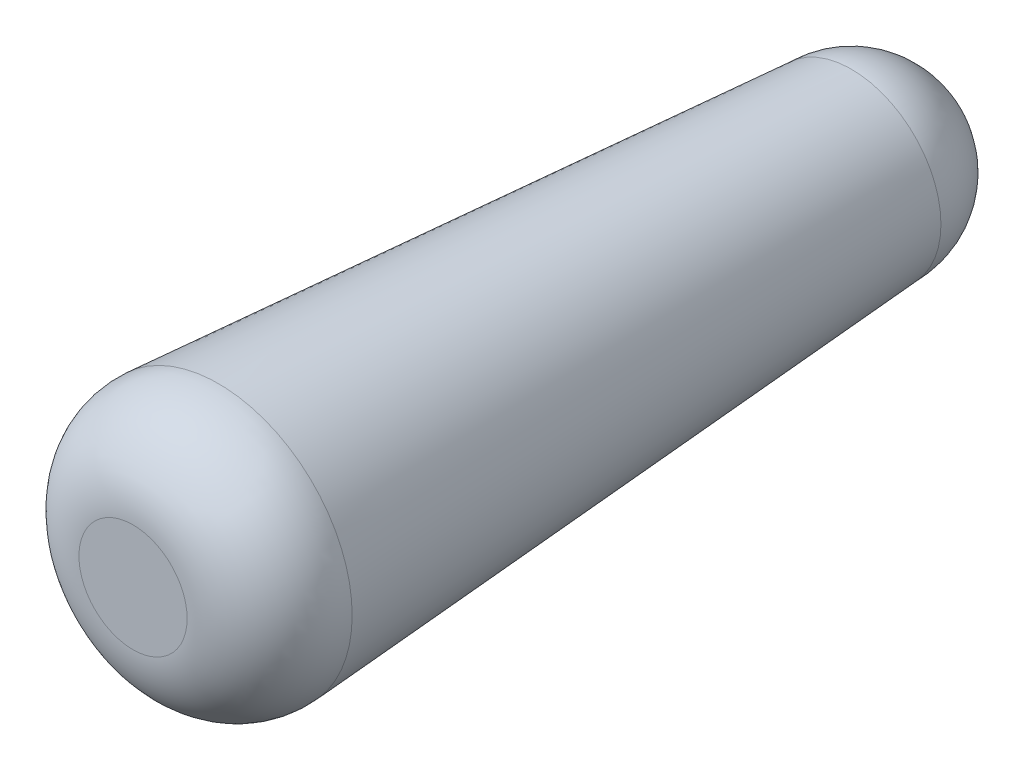
from build123d import *
from build123d.topology import SkipClean

# Parameters (mm, degrees)
SKETCH3_R           = 88.9
BOSS_EXTRUDE1_DEPTH = 457.2
BOSS_EXTRUDE1_DRAFT = -4
FILLET1_R           = 50.8


with BuildPart() as part:
    # Sketch3 → Boss-Extrude1 (with draft: the straight prism first)
    with BuildSketch(Plane.XY):
        Circle(SKETCH3_R)
    extrude(amount=-BOSS_EXTRUDE1_DEPTH)
    # Boss-Extrude1: the draft: its side faces are tilted about the plane it starts from
    boss_extrude1_sides = [part.faces().sort_by_distance(p)[0] for p in [
        (-88.9, 0, -228.6),
    ]]
    draft(boss_extrude1_sides, Plane.XY, BOSS_EXTRUDE1_DRAFT)

    # Sketch6 → Revolve1 (revolve)
    with SkipClean():  # the faces are left unmerged after this step: merging them gives an invalid solid
        with BuildSketch(Plane(origin=(0, 0, 0), x_dir=(0, 0, -1), z_dir=(1, 0, 0))):
            with BuildLine():
                Line((457.2, -56.929461579), (457.2, 56.929461579))
                ThreePointArc((457.2, 56.929461579), (514.129461579, 0), (457.2, -56.929461579))
            make_face()
        revolve(axis=Axis((0, -56.929461579, -457.2), (0, 1, 0)))

    # Fillet1
    fillet1_edges = [part.edges().sort_by_distance(p)[0] for p in [
        (-88.9, 0, 0),
    ]]
    fillet(fillet1_edges, radius=FILLET1_R)


solid = part.part
